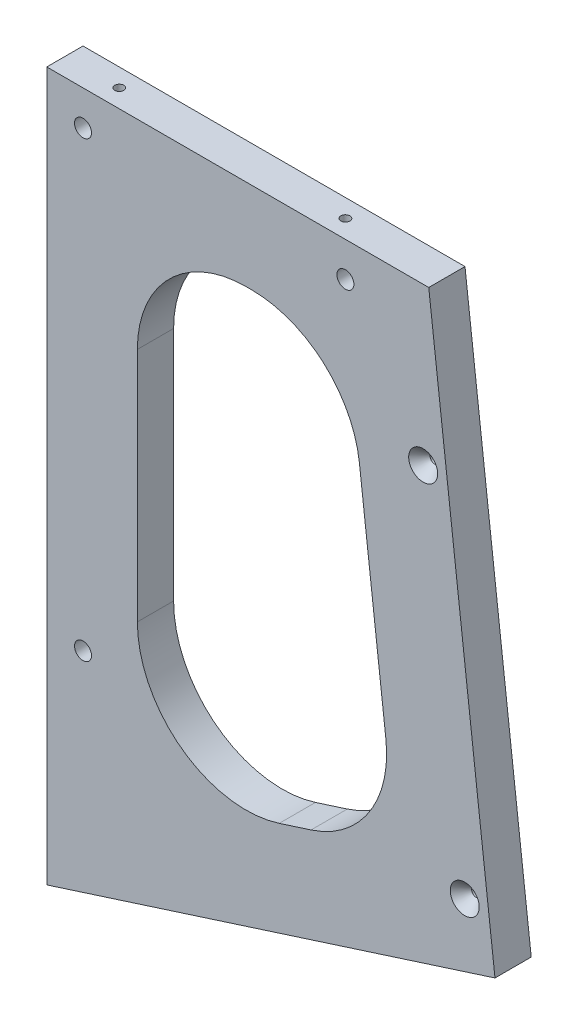
from build123d import *

# Parameters (mm, degrees)
BOSS_EXTRUDE1_DEPTH              = 12.7
HOLE3_D                          = 3.175
HOLE3_DEPTH                      = 31.75
HOLE3_CSINK_D                    = 10.16
HOLE3_CSINK_ANGLE                = 82
HOLE3_TIP                        = 0.953866233
HOLE6_D                          = 3.175
HOLE6_DEPTH                      = 38.1
HOLE6_CSINK_D                    = 10.16
HOLE6_CSINK_ANGLE                = 82
HOLE6_TIP                        = 0.953866233
HOLE7_D                          = 3.175
HOLE7_DEPTH                      = 31.75
HOLE7_CSINK_D                    = 10.16
HOLE7_CSINK_ANGLE                = 82
HOLE7_TIP                        = 0.953866233
HOLE8_D                          = 3.175
HOLE8_DEPTH                      = 31.75
HOLE8_CSINK_D                    = 10.16
HOLE8_CSINK_ANGLE                = 82
HOLE8_TIP                        = 0.953866233
F_15_64_0_23438_DIAMETER_HOLE1_D = 5.953252
F_15_64_0_23438_DIAMETER_HOLE2_D = 5.953252
CUT_EXTRUDE1_DEPTH               = 334.311975083
FILLET1_R                        = 38.1


with BuildPart() as part:
    # Sketch1 → Boss-Extrude1 (new body)
    with BuildSketch(Plane.XY):
        Polygon((-88.190159952, 0), (-222.052967181, 0), (-222.052967181, -248.25), (-64.977416983, -197.966048293), align=None)
    extrude(amount=-BOSS_EXTRUDE1_DEPTH)

    # Hole3
    with Locations(Plane(origin=(-234.752967181, 1073.364195846, -135.816741379), x_dir=(0, 0, -1), z_dir=(-1, 0, 0))):
        with Locations((-129.466741379, 1300.662770337), (-129.466741379, 1128.612770337), (129.198788767, 1128.612770337), (129.198788767, 1300.662770337)):
            CounterSinkHole(HOLE3_D / 2, HOLE3_CSINK_D / 2, depth=HOLE3_DEPTH, counter_sink_angle=HOLE3_CSINK_ANGLE)
            with Locations((0, 0, -(HOLE3_DEPTH + HOLE3_TIP / 2))):  # 118° drill point
                Cone(0, HOLE3_D / 2, HOLE3_TIP, mode=Mode.SUBTRACT)

    # Hole6
    with Locations(Plane(origin=(181.039434513, 1073.364195846, 0), x_dir=(-0.9271838545667885, -0.3746065934159093, 0), z_dir=(0, 0, 1))):
        with Locations((707.166557203, 1065.270372796), (674.127983646, 944.603090451)):
            CounterSinkHole(HOLE6_D / 2, HOLE6_CSINK_D / 2, depth=HOLE6_DEPTH, counter_sink_angle=HOLE6_CSINK_ANGLE)
            with Locations((0, 0, -(HOLE6_DEPTH + HOLE6_TIP / 2))):  # 118° drill point
                Cone(0, HOLE6_D / 2, HOLE6_TIP, mode=Mode.SUBTRACT)

    # Hole7
    with Locations(Plane(origin=(181.039434513, 12.7, -135.816741379), x_dir=(0, 0, -1), z_dir=(0, 1, 0))):
        with Locations((129.198788767, 384.042401694), (-129.466741379, 384.042401694), (-129.466741379, 304.786761906), (-110.416741379, 409.442401694), (-0.133976306, 409.442401694), (110.148788767, 409.442401694), (129.198788767, 304.786761906)):
            CounterSinkHole(HOLE7_D / 2, HOLE7_CSINK_D / 2, depth=HOLE7_DEPTH, counter_sink_angle=HOLE7_CSINK_ANGLE)
            with Locations((0, 0, -(HOLE7_DEPTH + HOLE7_TIP / 2))):  # 118° drill point
                Cone(0, HOLE7_D / 2, HOLE7_TIP, mode=Mode.SUBTRACT)

    # Hole8
    with Locations(Plane(origin=(531.197640696, -20.449854654, -135.816741379), x_dir=(0, 0, 1), z_dir=(0.3048844921716131, -0.9523893355310409, 0))):
        with Locations((-129.257383629, 761.035393152), (129.466741379, 663.01461615), (129.466741379, 760.835922116), (-129.408220012, 663.214203478)):
            CounterSinkHole(HOLE8_D / 2, HOLE8_CSINK_D / 2, depth=HOLE8_DEPTH, counter_sink_angle=HOLE8_CSINK_ANGLE)
            with Locations((0, 0, -(HOLE8_DEPTH + HOLE8_TIP / 2))):  # 118° drill point
                Cone(0, HOLE8_D / 2, HOLE8_TIP, mode=Mode.SUBTRACT)

    # 15/64 (0.23438) Diameter Hole1 (through all)
    with Locations(Plane.XY):
        with Locations((-117.397327374, -12.17947903), (-209.352967162, -12.179479032)):
            Hole(F_15_64_0_23438_DIAMETER_HOLE1_D / 2)

    # 15/64 (0.23438) Diameter Hole2 (through all)
    with Locations(Plane.XY):
        with Locations((-209.352967181, -170.846075828)):
            Hole(F_15_64_0_23438_DIAMETER_HOLE2_D / 2)

    # Sketch22 → Cut-Extrude1 (cut, through all)
    with BuildSketch(Plane.XY):
        Polygon((-99.555964999, -175.698330504), (-116.434796625, -31.75), (-190.302967181, -31.75), (-190.302967181, -204.748796153), align=None)
    extrude(amount=-CUT_EXTRUDE1_DEPTH, mode=Mode.SUBTRACT)

    # Fillet1
    fillet1_edges = [part.edges().sort_by_distance(p)[0] for p in [
        (-99.555964999, -175.698330504, -6.35),
        (-116.434796625, -31.75, -6.35),
        (-190.302967181, -31.75, -6.35),
        (-190.302967181, -204.748796153, -6.35),
    ]]
    fillet(fillet1_edges, radius=FILLET1_R)


solid = part.part
